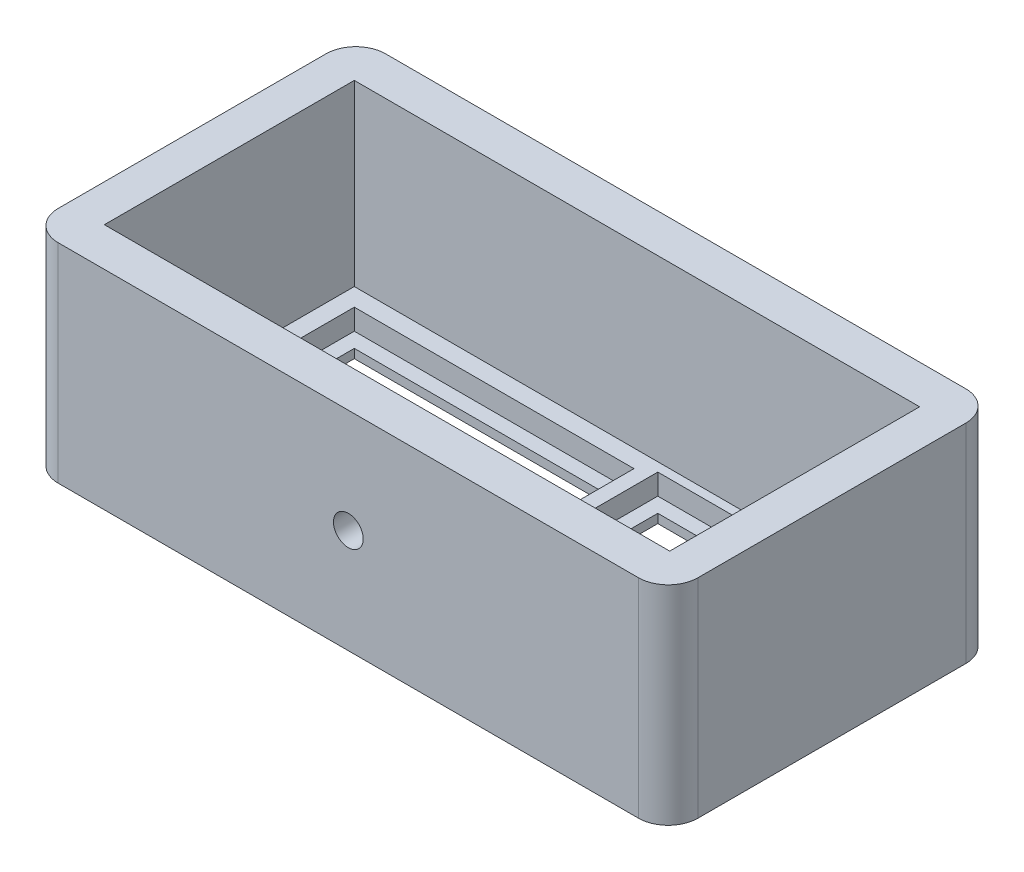
from build123d import *

# Parameters (mm, degrees)
BOSS_EXTRUDE1_DEPTH = 2
SKETCH2_W           = 18.8
SKETCH2_H           = 15.2
SKETCH2_W_2         = 15.8
SKETCH2_H_2         = 15.8
CUT_EXTRUDE1_DEPTH  = 1.4
SKETCH3_W           = 16.8
SKETCH3_H           = 13.2
SKETCH3_W_2         = 13.8
SKETCH3_H_2         = 13.8
CUT_EXTRUDE2_DEPTH  = 25.191114071
BOSS_EXTRUDE3_DEPTH = 12
FILLET1_R           = 10
SKETCH15_W          = 38
SKETCH15_H          = 16.8
CUT_EXTRUDE3_DEPTH  = 27.96757312
CUT_EXTRUDE5_REACH  = 35.797
SKETCH17_R          = 1


with BuildPart() as part:
    # Sketch1 → Boss-Extrude1 (new body)
    with BuildSketch(Plane(origin=(0, 0, 0), x_dir=(1, 0, 0), z_dir=(0, 1, 0))):
        with BuildLine():
            Line((19.5, -11), (-19.5, -11))
            ThreePointArc((-19.5, -11), (-20.914213562, -10.414213562), (-21.5, -9))
            Line((-21.5, -9), (-21.5, 9))
            ThreePointArc((-21.5, 9), (-20.914213562, 10.414213562), (-19.5, 11))
            Line((-19.5, 11), (19.5, 11))
            ThreePointArc((19.5, 11), (20.914213562, 10.414213562), (21.5, 9))
            Line((21.5, 9), (21.5, -9))
            ThreePointArc((21.5, -9), (20.914213562, -10.414213562), (19.5, -11))
        make_face()
    extrude(amount=BOSS_EXTRUDE1_DEPTH)

    # Sketch2 → Cut-Extrude1 (cut)
    with BuildSketch(Plane(origin=(0, 2, 0), x_dir=(1, 0, 0), z_dir=(0, 1, 0))):
        with Locations((-8.4, -0.4)):
            Rectangle(SKETCH2_W, SKETCH2_H)
        with Locations((9.9, -0.1)):
            Rectangle(SKETCH2_W_2, SKETCH2_H_2)
    extrude(amount=-CUT_EXTRUDE1_DEPTH, mode=Mode.SUBTRACT)

    # Sketch3 → Cut-Extrude2 (cut, through all)
    with BuildSketch(Plane(origin=(0, 0.6, 0), x_dir=(1, 0, 0), z_dir=(0, 1, 0))):
        with Locations((-8.4, -0.4)):
            Rectangle(SKETCH3_W, SKETCH3_H)
        with Locations((9.9, -0.1)):
            Rectangle(SKETCH3_W_2, SKETCH3_H_2)
    extrude(amount=-CUT_EXTRUDE2_DEPTH, mode=Mode.SUBTRACT)

    # Sketch13 → Boss-Extrude3 (add)
    with BuildSketch(Plane(origin=(0, 2, 0), x_dir=(1, 0, 0), z_dir=(0, 1, 0))):
        with BuildLine():
            ThreePointArc((-21.5, -9), (-20.914213562, -10.414213562), (-19.5, -11))
            Line((-19.5, -11), (19.5, -11))
            ThreePointArc((19.5, -11), (20.914213562, -10.414213562), (21.5, -9))
            Line((21.5, -9), (21.5, 9))
            ThreePointArc((21.5, 9), (20.914213562, 10.414213562), (19.5, 11))
            Line((19.5, 11), (-19.5, 11))
            ThreePointArc((-19.5, 11), (-20.914213562, 10.414213562), (-21.5, 9))
            Line((-21.5, 9), (-21.5, -9))
        make_face()
        with BuildLine():
            ThreePointArc((17.5, 8), (18.207106781, 7.707106781), (18.5, 7))
            Line((18.5, 7), (18.5, -7))
            ThreePointArc((18.5, -7), (18.306225775, -7.591607978), (17.8, -7.953939201))
            Line((17.8, -7.953939201), (17.8, -8))
            Line((17.8, -8), (-17.8, -8))
            Line((-17.8, -8), (-17.8, -7.953939201))
            ThreePointArc((-17.8, -7.953939201), (-18.306225775, -7.591607978), (-18.5, -7))
            Line((-18.5, -7), (-18.5, 7))
            ThreePointArc((-18.5, 7), (-18.207106781, 7.707106781), (-17.5, 8))
            Line((-17.5, 8), (17.5, 8))
        make_face(mode=Mode.SUBTRACT)
    extrude(amount=BOSS_EXTRUDE3_DEPTH)

    # Fillet1
    # the kernel refuses this fillet: 10 mm, written as the material it takes off along each edge
    with BuildSketch(Plane(origin=(17.8, 2, 7.953939201), x_dir=(0.906100611464274, 0, -0.42306226717123885), z_dir=(0, 1, 0))) as fillet1_piece_1:
        with BuildLine():
            CenterArc((1.580945974, -9.912835739), FILLET1_R, 97.570469618, 1.638937345)
            Line((-0.019486586, -0.041735718), (0, 0))
            ThreePointArc((0, 0), (0.131745498, -0.008716426), (0.263490996, 0))
        make_face()
    extrude(amount=12.658727489, mode=Mode.SUBTRACT)

    # Sketch15 → Cut-Extrude3 (cut, through all)
    with BuildSketch(Plane(origin=(0, 2, 0), x_dir=(1, 0, 0), z_dir=(0, 1, 0))):
        Rectangle(SKETCH15_W, SKETCH15_H)
    extrude(amount=CUT_EXTRUDE3_DEPTH, mode=Mode.SUBTRACT)

    # Sketch17 → Cut-Extrude5 (cut, up to next)
    with BuildSketch(Plane.XY.offset(11), mode=Mode.PRIVATE) as cut_extrude5_sk1:
        with Locations((0, 7)):
            Circle(SKETCH17_R)
    cut_extrude5_tool1 = extrude(cut_extrude5_sk1.sketch, amount=-CUT_EXTRUDE5_REACH, mode=Mode.PRIVATE) & part.part
    add(cut_extrude5_tool1.solids().sort_by_distance((0, 7, 11))[0], mode=Mode.SUBTRACT)


solid = part.part
